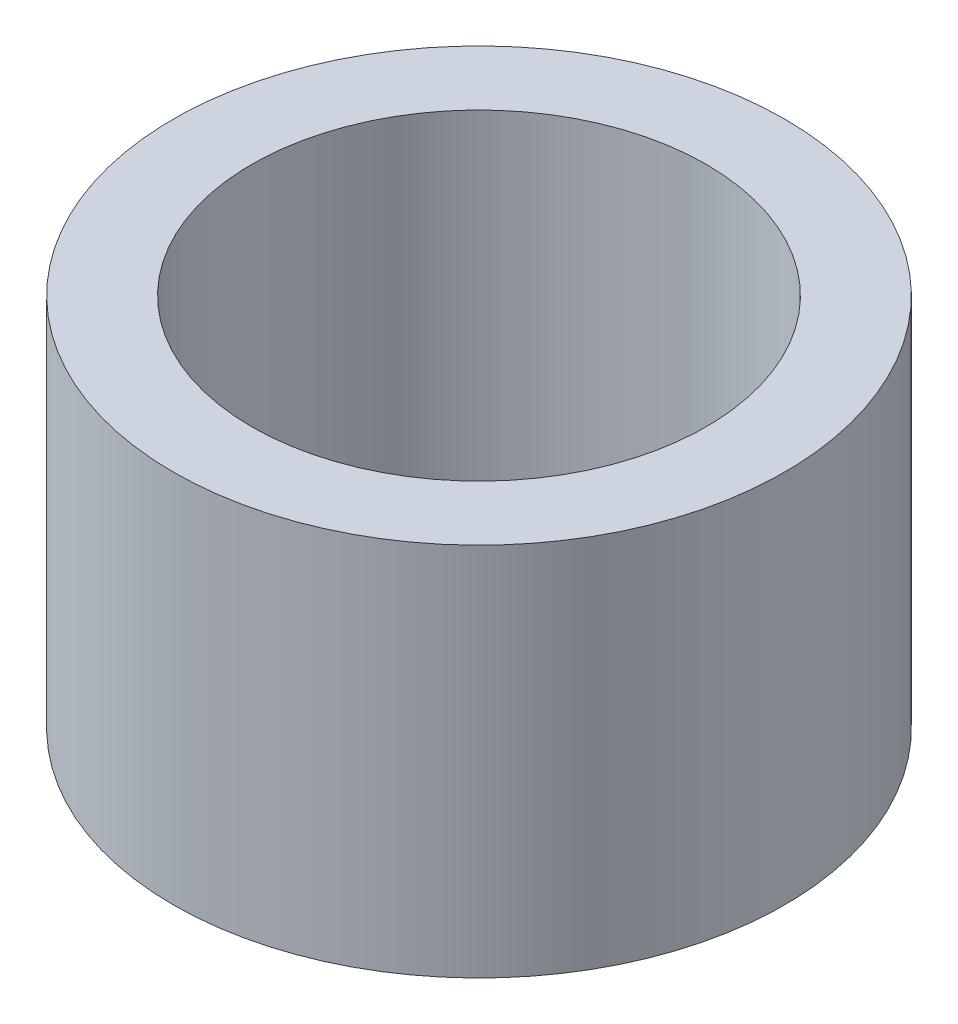
from build123d import *

# Parameters (mm, degrees)
SKETCH1_R           = 25
BOSS_EXTRUDE1_DEPTH = 30.654386628
SKETCH2_R           = 18.587122373
CUT_EXTRUDE1_DEPTH  = 47.794138731


with BuildPart() as part:
    # Sketch1 → Boss-Extrude1 (new body)
    with BuildSketch(Plane(origin=(0, 0, 0), x_dir=(1, 0, 0), z_dir=(0, 1, 0))):
        Circle(SKETCH1_R)
    extrude(amount=BOSS_EXTRUDE1_DEPTH)

    # Sketch2 → Cut-Extrude1 (cut, through all)
    with BuildSketch(Plane(origin=(0, 0, 0), x_dir=(1, 0, 0), z_dir=(0, 1, 0))):
        Circle(SKETCH2_R)
    extrude(amount=CUT_EXTRUDE1_DEPTH, mode=Mode.SUBTRACT)


solid = part.part
